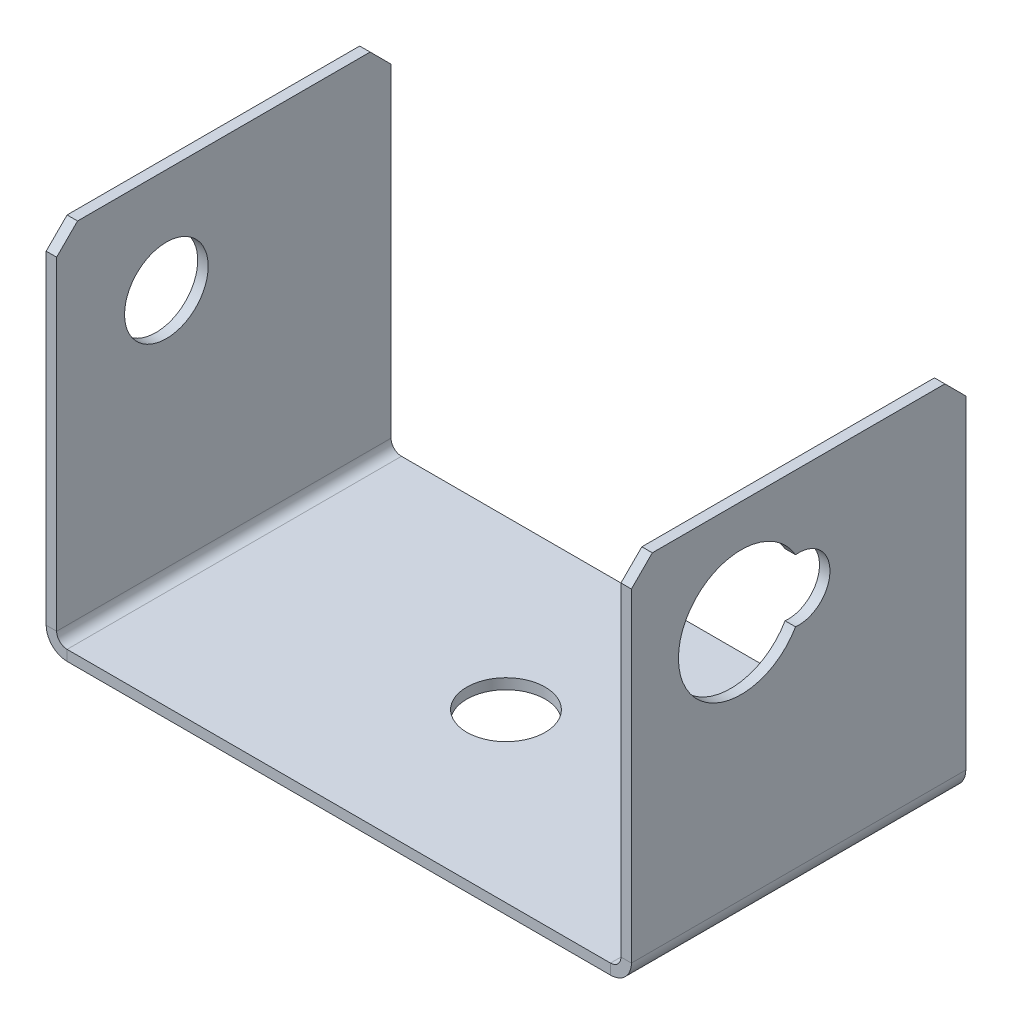
from build123d import *

# Parameters (mm, degrees)
BASE_FLANGE1_DEPTH = 32
CUT_EXTRUDE1_DEPTH = 10
SKETCH9_R          = 4
CUT_EXTRUDE2_DEPTH = 10
SKETCH10_R         = 3.75
CUT_EXTRUDE3_DEPTH = 10
CHAMFER2_SIZE      = 2


# Sheet-metal steps are written as plain solids
with BuildPart() as part:
    # Sketch1 → Base-Flange1 (new body)
    with BuildSketch(Plane.XY):
        with BuildLine():
            Line((0, 35), (0, 2))
            ThreePointArc((0, 2), (0.585786438, 0.585786438), (2, 0))
            Line((2, 0), (54, 0))
            ThreePointArc((54, 0), (55.414213562, 0.585786438), (56, 2))
            Line((56, 2), (56, 35))
            Line((56, 35), (55, 35))
            Line((55, 35), (55, 2))
            ThreePointArc((55, 2), (54.707106781, 1.292893219), (54, 1))
            Line((54, 1), (2, 1))
            ThreePointArc((2, 1), (1.292893219, 1.292893219), (1, 2))
            Line((1, 2), (1, 35))
            Line((1, 35), (0, 35))
        make_face()
    extrude(amount=BASE_FLANGE1_DEPTH)

    # Sketch8 → Cut-Extrude1 (cut)
    with BuildSketch(Plane(origin=(56, 0, 0), x_dir=(0, 0, -1), z_dir=(1, 0, 0))):
        with BuildLine():
            ThreePointArc((-16.295454545, 27.985415651), (-27.5, 25), (-16.295454545, 22.014584349))
            ThreePointArc((-16.295454545, 22.014584349), (-13, 25), (-16.295454545, 27.985415651))
        make_face()
    extrude(amount=-CUT_EXTRUDE1_DEPTH, mode=Mode.SUBTRACT)

    # Sketch9 → Cut-Extrude2 (cut)
    with BuildSketch(Plane.ZY):
        with Locations((21.5, 25)):
            Circle(SKETCH9_R)
    extrude(amount=-CUT_EXTRUDE2_DEPTH, mode=Mode.SUBTRACT)

    # Sketch10 → Cut-Extrude3 (cut)
    with BuildSketch(Plane(origin=(0, 1, 0), x_dir=(1, 0, 0), z_dir=(0, 1, 0))):
        with Locations(Location((28, -16, 0), (0, 0, 270))):
            Circle(SKETCH10_R)
    extrude(amount=-CUT_EXTRUDE3_DEPTH, mode=Mode.SUBTRACT)

    # Chamfer2
    chamfer2_edges = [part.edges().sort_by_distance(p)[0] for p in [
        (0.5, 35, 0),
        (55.5, 35, 0),
        (0.5, 35, 32),
        (55.5, 35, 32),
    ]]
    chamfer(chamfer2_edges, length=CHAMFER2_SIZE)


solid = part.part
